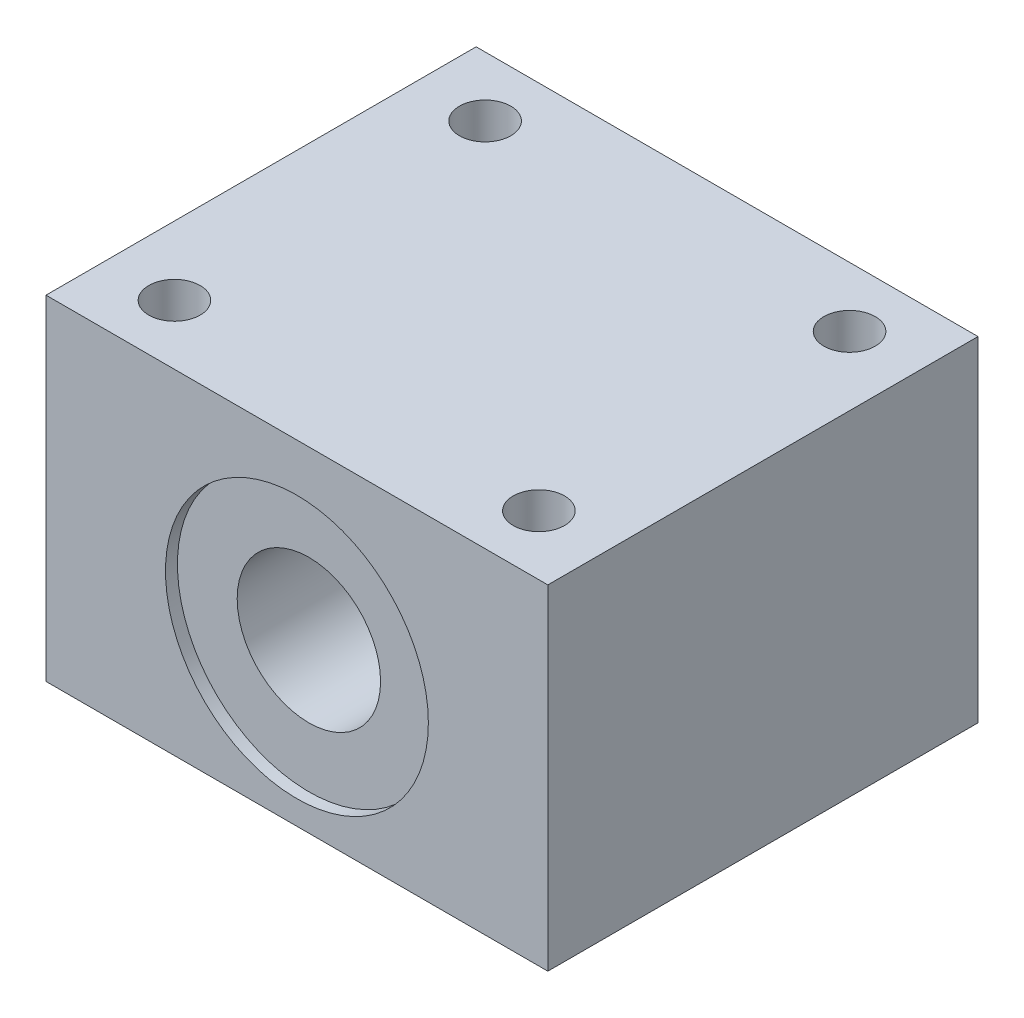
from build123d import *

# Parameters (mm, degrees)
SKETCH1_W           = 42
SKETCH1_H           = 28
SKETCH1_R           = 6
BOSS_EXTRUDE1_DEPTH = 18
SKETCH2_R           = 2.15
CUT_EXTRUDE1_DEPTH  = 40.357337308
SKETCH3_R           = 2.5
CUT_EXTRUDE2_DEPTH  = 12
SKETCH4_R           = 11
CUT_EXTRUDE3_DEPTH  = 1
CUT_EXTRUDE4_START  = -1
SKETCH5_R           = 11
CUT_EXTRUDE4_DEPTH  = 1


with BuildPart() as part:
    # Sketch1 → Boss-Extrude1 (new, symmetric)
    with BuildSketch(Plane.XY):
        Rectangle(SKETCH1_W, SKETCH1_H)
        with Locations((0, -1)):
            Circle(SKETCH1_R, mode=Mode.SUBTRACT)
    extrude(amount=BOSS_EXTRUDE1_DEPTH, both=True)

    # Sketch2 → Cut-Extrude1 (cut, through all)
    with BuildSketch(Plane(origin=(0, -14, 0), x_dir=(-1, 0, 0), z_dir=(0, -1, 0))):
        with Locations((15.25, -13)):
            Circle(SKETCH2_R)
        with Locations((-15.25, -13)):
            Circle(SKETCH2_R)
        with Locations((-15.25, 13)):
            Circle(SKETCH2_R)
        with Locations((15.25, 13)):
            Circle(SKETCH2_R)
    extrude(amount=-CUT_EXTRUDE1_DEPTH, mode=Mode.SUBTRACT)

    # Sketch3 → Cut-Extrude2 (cut)
    with BuildSketch(Plane.XZ.offset(14)):
        with Locations((-15.25, 13)):
            Circle(SKETCH3_R)
        with Locations((15.25, 13)):
            Circle(SKETCH3_R)
        with Locations((15.25, -13)):
            Circle(SKETCH3_R)
        with Locations((-15.25, -13)):
            Circle(SKETCH3_R)
    extrude(amount=-CUT_EXTRUDE2_DEPTH, mode=Mode.SUBTRACT)

    # Sketch4 → Cut-Extrude3 (cut)
    with BuildSketch(Plane.XY.offset(18)):
        with Locations((0, -1)):
            Circle(SKETCH4_R)
    extrude(amount=-CUT_EXTRUDE3_DEPTH, mode=Mode.SUBTRACT)

    # Sketch5 → Cut-Extrude4 (cut)
    with BuildSketch(Plane(origin=(0, 0, -18), x_dir=(-1, 0, 0), z_dir=(0, 0, -1)).offset(CUT_EXTRUDE4_START)):
        with Locations((0, -1)):
            Circle(SKETCH5_R)
    extrude(amount=CUT_EXTRUDE4_DEPTH, mode=Mode.SUBTRACT)


solid = part.part
